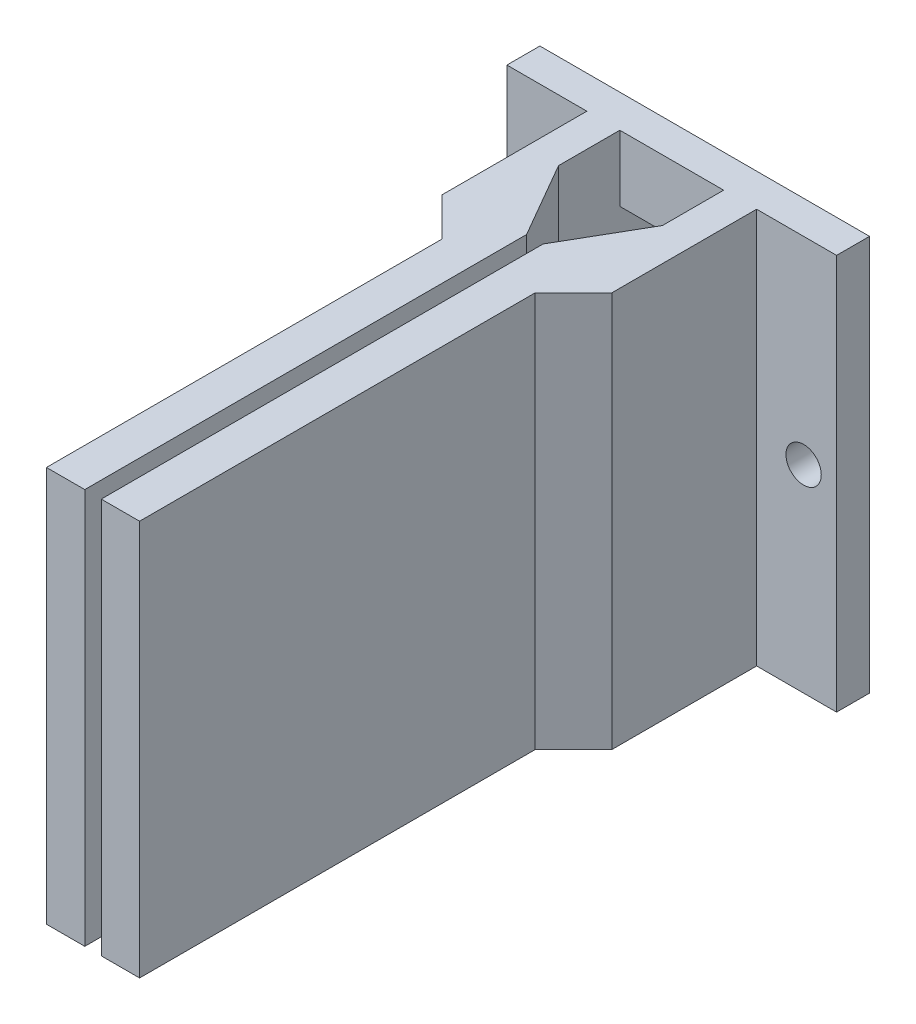
from build123d import *
from build123d.topology import SkipClean

# Parameters (mm, degrees)
SKETCH1_W                     = 10
SKETCH1_H                     = 170.55
SKETCH1_R                     = 2.5
BOSS_EXTRUDE1_DEPTH           = 2
SKETCH2_W                     = 10
SKETCH2_H                     = 170.55
SKETCH2_R                     = 2.95
BOSS_EXTRUDE2_DEPTH           = 1
SKETCH3_W                     = 69.85
SKETCH3_H                     = 10.16
SKETCH3_R                     = 1.86055
BOSS_EXTRUDE3_DEPTH           = 2.5
FILLET1_START                 = -1
FILLET1_DEPTH                 = 10.16
FILLET1_START_2               = -17.7000001
FILLET1_2_DEPTH               = 35.4000001
FILLET1_START_3               = -5
FILLET1_3_DEPTH               = 10
SKETCH4_W                     = 10
SKETCH4_H                     = 13.05
BOSS_EXTRUDE4_DEPTH           = 3
SKETCH4_3_W                   = 3.175
SKETCH4_3_H                   = 38.1
BOSS_EXTRUDE5_DEPTH           = 11.1125
SKETCH5_W                     = 7.38125
SKETCH5_H                     = 38.1
BOSS_EXTRUDE6_DEPTH           = 50.8
SKETCH6_W                     = 3.690625
SKETCH6_H                     = 38.1
CUT_EXTRUDE1_DEPTH            = 44.45
CHAMFER1_SIZE                 = 4.7625
CHAMFER1_SIZE_2               = 8.248891971
SKETCH7_W                     = 69.85
SKETCH7_H                     = 10.16
CUT_EXTRUDE2_DEPTH            = 145.5
SKETCH8_W                     = 31.75
SKETCH8_H                     = 38.1
BOSS_EXTRUDE7_DEPTH           = 3.175
SKETCH9_W                     = 10
SKETCH9_H                     = 3.175
SKETCH9_W_2                   = 16.35
SKETCH9_H_2                   = 3
CUT_EXTRUDE3_DEPTH            = 74.579605063
CHAMFER2_SIZE                 = 6.35
CHAMFER3_SIZE                 = 6.35
SKETCH11_W                    = 1.7
SKETCH11_H                    = 58.9125
M3_CLEARANCE_HOLE1_AT_2_COUNT = 2
M3_CLEARANCE_HOLE1_AT_2_PITCH = 25.4
SKETCH13_W                    = 10
SKETCH13_H                    = 6.35
BOSS_EXTRUDE8_DEPTH           = 3.175


with BuildPart() as part:
    # Sketch1 → Boss-Extrude1 (new body)
    with BuildSketch(Plane.XY):
        with Locations((0, 3)):
            Rectangle(SKETCH1_W, SKETCH1_H)
        with Locations((0, 82.275)):
            Circle(SKETCH1_R, mode=Mode.SUBTRACT)
    extrude(amount=BOSS_EXTRUDE1_DEPTH)

    # Sketch2 → Boss-Extrude2 (add)
    with BuildSketch(Plane(origin=(0, 0, 0), x_dir=(-1, 0, 0), z_dir=(0, 0, -1))):
        with Locations((0, 3)):
            Rectangle(SKETCH2_W, SKETCH2_H)
        with Locations((0, 82.275)):
            Circle(SKETCH2_R, mode=Mode.SUBTRACT)
    extrude(amount=BOSS_EXTRUDE2_DEPTH)

    # Sketch3 → Boss-Extrude3 (add)
    with BuildSketch(Plane.XZ.offset(82.275)):
        with Locations((0, 4.08)):
            Rectangle(SKETCH3_W, SKETCH3_H)
        with Locations(Location((28.575, 4.08, 0), (0, 0, 270))):
            Circle(SKETCH3_R, mode=Mode.SUBTRACT)
        with Locations(Location((-28.575, 4.08, 0), (0, 0, 270))):
            Circle(SKETCH3_R, mode=Mode.SUBTRACT)
    extrude(amount=-BOSS_EXTRUDE3_DEPTH)

    # Fillet1: read off the stored shape, not the designer's step
    # Fillet1 outline → Fillet1 (add)
    with BuildSketch(Plane.XY.offset(FILLET1_START)):
        with BuildLine():
            Line((5, -79.775), (17.7, -79.775))
            ThreePointArc((17.7, -79.775), (8.719743879, -76.055256121), (5, -67.075))
            Line((5, -67.075), (5, -79.775))
        make_face()
        with BuildLine():
            Line((-17.7, -79.775), (-5, -79.775))
            Line((-5, -79.775), (-5, -67.075))
            ThreePointArc((-5, -67.075), (-8.719743879, -76.055256121), (-17.7, -79.775))
        make_face()
    extrude(amount=FILLET1_DEPTH)

    # Fillet1 2 outline → Fillet1 2 (cut)
    with BuildSketch(Plane.YZ.offset(FILLET1_START_2)):
        with BuildLine():
            Line((-66, 9.16), (-79.775009155, 9.160018885))
            ThreePointArc((-79.775009155, 9.160018885), (-75.089891257, 3.937849653), (-68.347034302, 2))
            Line((-68.347034302, 2), (-66, 2))
            Line((-66, 2), (-66, 9.16))
        make_face()
    extrude(amount=FILLET1_2_DEPTH, mode=Mode.SUBTRACT)

    # Fillet1 3 outline → Fillet1 3 (add)
    with BuildSketch(Plane.YZ.offset(FILLET1_START_3)):
        with BuildLine():
            ThreePointArc((-68.347034302, 2), (-75.089891257, 3.937849653), (-79.775009155, 9.160018885))
            Line((-79.775009155, 9.160018885), (-79.775, 0))
            Line((-79.775, 0), (-66, 0))
            Line((-66, 0), (-66, 2))
            Line((-66, 2), (-68.347034302, 2))
        make_face()
    extrude(amount=FILLET1_3_DEPTH)

    # Sketch4 → Boss-Extrude4 (add)
    with SkipClean():  # the faces are left unmerged after this step: merging them gives an invalid solid
        with BuildSketch(Plane(origin=(0, 0, -1), x_dir=(-1, 0, 0), z_dir=(0, 0, -1))):
            Polygon((8.175, 63.225), (8.175, 101.325), (5, 101.325), (5, 88.275), (5, 63.225), align=None)
            with Locations((0, 94.8)):
                Rectangle(SKETCH4_W, SKETCH4_H)
            Polygon((-5, 88.275), (-5, 101.325), (-8.175, 101.325), (-8.175, 63.225), (-5, 63.225), align=None)
        extrude(amount=-BOSS_EXTRUDE4_DEPTH)

    # Sketch4<3> → Boss-Extrude5 (add)
    with SkipClean():  # the faces are left unmerged after this step: merging them gives an invalid solid
        with BuildSketch(Plane(origin=(0, 0, -1), x_dir=(-1, 0, 0), z_dir=(0, 0, -1))):
            with Locations((6.5875, 82.275)):
                Rectangle(SKETCH4_3_W, SKETCH4_3_H)
            with Locations((-6.5875, 82.275)):
                Rectangle(SKETCH4_3_W, SKETCH4_3_H)
        extrude(amount=-BOSS_EXTRUDE5_DEPTH)

    # Sketch5 → Boss-Extrude6 (add)
    with SkipClean():  # the faces are left unmerged after this step: merging them gives an invalid solid
        with BuildSketch(Plane.XY.offset(10.1125)):
            with Locations((-4.484375, 82.275)):
                Rectangle(SKETCH5_W, SKETCH5_H)
            with Locations((4.484375, 82.275)):
                Rectangle(SKETCH5_W, SKETCH5_H)
        extrude(amount=BOSS_EXTRUDE6_DEPTH)

    # Sketch6 → Cut-Extrude1 (cut)
    with SkipClean():  # the faces are left unmerged after this step: merging them gives an invalid solid
        with BuildSketch(Plane.XY.offset(60.9125)):
            with Locations((-6.3296875, 82.275)):
                Rectangle(SKETCH6_W, SKETCH6_H)
            with Locations((6.3296875, 82.275)):
                Rectangle(SKETCH6_W, SKETCH6_H)
        extrude(amount=-CUT_EXTRUDE1_DEPTH, mode=Mode.SUBTRACT)

    # Chamfer1
    # the kernel refuses this chamfer: 8.248891971, 4.7625 mm, written as the material it takes off along each edge
    with BuildSketch(Plane(origin=(-0.79375, 122.66559091, 10.1125), x_dir=(-1, 0, 0), z_dir=(0, -1, 0))) as chamfer1_piece_1_section:
        Polygon((CHAMFER1_SIZE, 0), (0, -CHAMFER1_SIZE_2), (0, 0), align=None)
    chamfer1_piece_1 = extrude(amount=80.78118182, mode=Mode.PRIVATE)
    chamfer1_piece_1 = split(chamfer1_piece_1, bisect_by=Plane(origin=(-5, 122.66559091, 10.1125), z_dir=(1, 0, 0)), keep=Keep.TOP, mode=Mode.PRIVATE)
    add(chamfer1_piece_1, mode=Mode.SUBTRACT)
    with BuildSketch(Plane(origin=(0.79375, 122.66559091, 10.1125), x_dir=(1, 0, 0), z_dir=(0, -1, 0))) as chamfer1_piece_2_section:
        Polygon((CHAMFER1_SIZE, 0), (0, CHAMFER1_SIZE_2), (0, 0), align=None)
    chamfer1_piece_2 = extrude(amount=80.78118182, mode=Mode.PRIVATE)
    chamfer1_piece_2 = split(chamfer1_piece_2, bisect_by=Plane(origin=(5, 122.66559091, 10.1125), z_dir=(-1, 0, 0)), keep=Keep.TOP, mode=Mode.PRIVATE)
    add(chamfer1_piece_2, mode=Mode.SUBTRACT)

    # Sketch7 → Cut-Extrude2 (cut)
    with BuildSketch(Plane.XZ.offset(82.275)):
        with Locations((0, 4.08)):
            Rectangle(SKETCH7_W, SKETCH7_H)
    extrude(amount=-CUT_EXTRUDE2_DEPTH, mode=Mode.SUBTRACT)


with BuildPart() as cut_extrude2_kept_piece:
    # of the separate pieces the step leaves, the one the design keeps (cut_extrude2_pieces_kept)
    add(part.part.solids().sort_by_distance((-8.175, 63.225, -1))[0])

    # Sketch8 → Boss-Extrude7 (add)
    with BuildSketch(Plane(origin=(0, 0, 2), x_dir=(-1, 0, 0), z_dir=(0, 0, -1))):
        with Locations((0, 82.275)):
            Rectangle(SKETCH8_W, SKETCH8_H)
    extrude(amount=-BOSS_EXTRUDE7_DEPTH)

    # Sketch9 → Cut-Extrude3 (cut, through all)
    with BuildSketch(Plane(origin=(0, 101.325, 0), x_dir=(1, 0, 0), z_dir=(0, 1, 0))):
        with Locations((0, -3.5875)):
            Rectangle(SKETCH9_W, SKETCH9_H)
        with Locations((0, -0.5)):
            Rectangle(SKETCH9_W_2, SKETCH9_H_2)
    extrude(amount=-CUT_EXTRUDE3_DEPTH, mode=Mode.SUBTRACT)


with BuildPart() as cut_extrude3_piece_1:
    # of the separate pieces the step leaves, piece 1, a body of its own (cut_extrude3_pieces)
    add(cut_extrude2_kept_piece.part.solids().sort_by_distance((-15.875, 101.325, 2))[0])

    # Chamfer3
    # the kernel refuses this chamfer: 6.35 mm, written as the material it adds along each edge
    with BuildSketch(Plane(origin=(-4.484375, 101.325, 16.4625), x_dir=(-1, 0, 0), z_dir=(0, -1, 0))) as chamfer3_piece_1_section:
        Polygon((CHAMFER3_SIZE, 0), (0, -CHAMFER3_SIZE), (0, 0), align=None)
    chamfer3_piece_1 = extrude(amount=38.1, mode=Mode.PRIVATE)
    chamfer3_piece_1 = split(chamfer3_piece_1, bisect_by=Plane(origin=(-8.175, 101.325, 16.4625), z_dir=(1, 0, 0)), keep=Keep.TOP, mode=Mode.PRIVATE)
    add(chamfer3_piece_1)

    # Sketch11 → M3 Clearance Hole1 (revolve, cut)
    with BuildSketch(Plane(origin=(-12.7, 82.275, 2), x_dir=(0, 1, 0), z_dir=(1, 0, 0))):
        with Locations((0.85, 29.45625)):
            Rectangle(SKETCH11_W, SKETCH11_H)
    m3_clearance_hole1 = revolve(axis=Axis((-12.7, 82.275, -4.35), (0, 0, 1)), mode=Mode.SUBTRACT)



with BuildPart() as cut_extrude3_piece_2:
    # of the separate pieces the step leaves, piece 2, a body of its own (cut_extrude3_pieces)
    add(cut_extrude2_kept_piece.part.solids().sort_by_distance((15.875, 101.325, 2))[0])

    # Chamfer2
    # the kernel refuses this chamfer: 6.35 mm, written as the material it adds along each edge
    with BuildSketch(Plane(origin=(4.484375, 101.325, 16.4625), x_dir=(1, 0, 0), z_dir=(0, -1, 0))) as chamfer2_piece_1_section:
        Polygon((CHAMFER2_SIZE, 0), (0, CHAMFER2_SIZE), (0, 0), align=None)
    chamfer2_piece_1 = extrude(amount=38.1, mode=Mode.PRIVATE)
    chamfer2_piece_1 = split(chamfer2_piece_1, bisect_by=Plane(origin=(8.175, 101.325, 16.4625), z_dir=(-1, 0, 0)), keep=Keep.TOP, mode=Mode.PRIVATE)
    add(chamfer2_piece_1)

    # M3 Clearance Hole1 at 2: M3 Clearance Hole1 ×2
    with Locations(*[(i * M3_CLEARANCE_HOLE1_AT_2_PITCH, 0, 0) for i in range(1, M3_CLEARANCE_HOLE1_AT_2_COUNT)]):
        add(m3_clearance_hole1, mode=Mode.SUBTRACT)


with BuildPart() as cut_extrude3_piece_1_1:
    add(cut_extrude3_piece_1.part)

    add(cut_extrude3_piece_2.part)  # Boss-Extrude8 merges Cut-Extrude3 piece 2
    # Sketch13 → Boss-Extrude8 (add)
    with BuildSketch(Plane(origin=(0, 0, 2), x_dir=(-1, 0, 0), z_dir=(0, 0, -1))):
        with Locations((0, 98.15)):
            Rectangle(SKETCH13_W, SKETCH13_H)
        with Locations((0, 66.4)):
            Rectangle(SKETCH13_W, SKETCH13_H)
    extrude(amount=-BOSS_EXTRUDE8_DEPTH)


solid = cut_extrude3_piece_1_1.part
